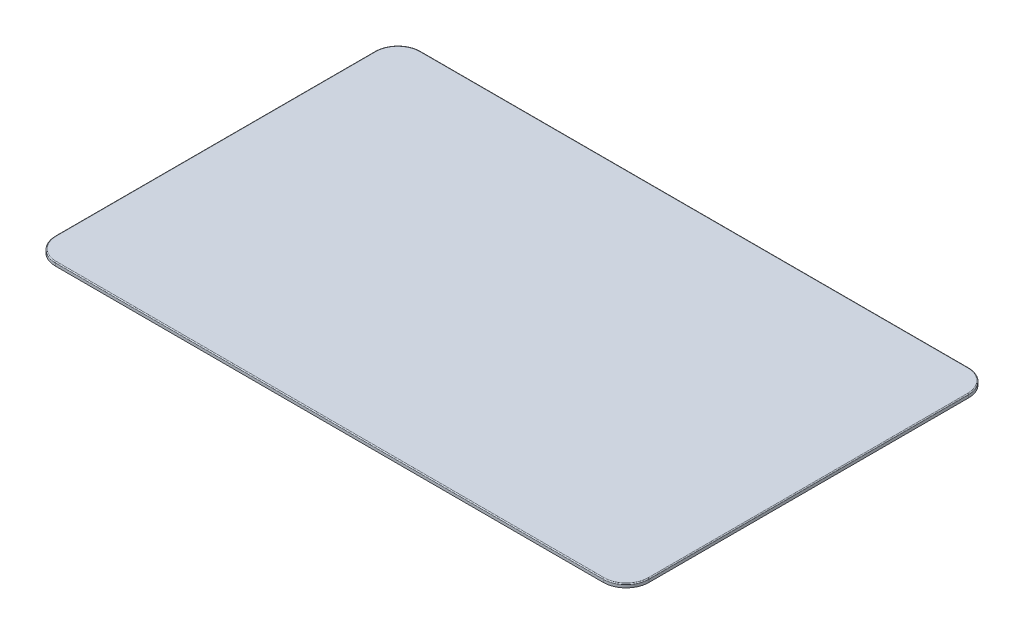
from build123d import *

# Parameters (mm, degrees)
EXTRUDE_1_DEPTH     = 8
FILLET_1_R          = 2
CUT_EXTRUDE_1_DEPTH = 6


with BuildPart() as part:
    # Эскиз1 → Бобышка-Вытянуть1 (new body)
    with BuildSketch(Plane(origin=(0, 0, 0), x_dir=(1, 0, 0), z_dir=(0, 1, 0))):
        with BuildLine():
            Line((-600, -400), (600, -400))
            ThreePointArc((600, -400), (635.355339059, -385.355339059), (650, -350))
            Line((650, -350), (650, 350))
            ThreePointArc((650, 350), (635.355339059, 385.355339059), (600, 400))
            Line((600, 400), (-600, 400))
            ThreePointArc((-600, 400), (-635.355339059, 385.355339059), (-650, 350))
            Line((-650, 350), (-650, -350))
            ThreePointArc((-650, -350), (-635.355339059, -385.355339059), (-600, -400))
        make_face()
    extrude(amount=EXTRUDE_1_DEPTH)

    # Скругление1
    fillet_1_edges = [part.edges().sort_by_distance(p)[0] for p in [
        (-635.355339059, 8, -385.355339059),
        (0, 8, -400),
        (635.355339059, 8, -385.355339059),
        (650, 8, 0),
        (635.355339059, 8, 385.355339059),
        (0, 8, 400),
        (-635.355339059, 8, 385.355339059),
        (-650, 8, 0),
    ]]
    fillet(fillet_1_edges, radius=FILLET_1_R)

    # Эскиз2 → Вырез-Вытянуть1 (cut)
    with BuildSketch(Plane.XZ):
        with BuildLine():
            Line((-505.5, -118.713883744), (-423, -118.713883744))
            ThreePointArc((-423, -118.713883744), (-419.464466094, -117.24941765), (-418, -113.713883744))
            Line((-418, -113.713883744), (-418, -29.5))
            ThreePointArc((-418, -29.5), (-416.535533906, -25.964466094), (-413, -24.5))
            ThreePointArc((-413, -24.5), (-409.464466094, -23.035533906), (-408, -19.5))
            ThreePointArc((-408, -19.5), (-406.535533906, -15.964466094), (-403, -14.5))
            Line((-403, -14.5), (-297.5, -14.5))
            Line((-297.5, -14.5), (-297.5, -207.927682204))
            ThreePointArc((-297.5, -207.927682204), (-298.971774478, -211.470509418), (-302.520649868, -212.927639562))
            Line((-302.520649868, -212.927639562), (-307.759216244, -212.906004237))
            ThreePointArc((-307.759216244, -212.906004237), (-312.019645969, -211.120626595), (-310.269519857, -215.395657982))
            Line((-310.269519857, -215.395657982), (-310.538832295, -280.604342018))
            ThreePointArc((-310.538832295, -280.604342018), (-312.320570836, -284.868433457), (-308.049157229, -283.104320697))
            Line((-308.049157229, -283.104320697), (-262.240805077, -283.104320697))
            ThreePointArc((-262.240805077, -283.104320697), (-257.973038124, -284.87208765), (-259.740805077, -280.604320697))
            Line((-259.740805077, -280.604320697), (-259.740805077, -218.125013383))
            ThreePointArc((-259.740805077, -218.125013383), (-258.269030598, -214.582186169), (-254.720155209, -213.125056025))
            Line((-254.720155209, -213.125056025), (-250, -213.144550308))
            Line((-250, -213.144550308), (-245.27984479, -213.125056025))
            ThreePointArc((-245.27984479, -213.125056025), (-241.730969401, -214.582186169), (-240.259194922, -218.125013383))
            Line((-240.259194922, -218.125013383), (-240.259194922, -280.604320697))
            ThreePointArc((-240.259194922, -280.604320697), (-242.026961875, -284.87208765), (-237.759194922, -283.104320697))
            Line((-237.759194922, -283.104320697), (-191.95084277, -283.104320697))
            ThreePointArc((-191.95084277, -283.104320697), (-187.679429163, -284.868433457), (-189.461167704, -280.604342018))
            Line((-189.461167704, -280.604342018), (-189.730480142, -215.395657982))
            ThreePointArc((-189.730480142, -215.395657982), (-187.98035403, -211.120626595), (-192.240783755, -212.906004237))
            Line((-192.240783755, -212.906004237), (-197.479350132, -212.927639562))
            ThreePointArc((-197.479350132, -212.927639562), (-201.028225521, -211.470509418), (-202.499999999, -207.927682204))
            Line((-202.499999999, -207.927682204), (-202.499999999, -179.286116256))
            ThreePointArc((-202.499999999, -179.286116256), (-203.964466093, -175.75058235), (-207.499999999, -174.286116256))
            Line((-207.499999999, -174.286116256), (-265.499999999, -174.286116256))
            ThreePointArc((-265.499999999, -174.286116256), (-269.035533905, -172.821650162), (-270.499999999, -169.286116256))
            Line((-270.499999999, -169.286116256), (-270.499999999, 174.286116256))
            ThreePointArc((-270.499999999, 174.286116256), (-269.035533905, 177.821650162), (-265.499999999, 179.286116256))
            Line((-265.499999999, 179.286116256), (-207.499999999, 179.286116256))
            ThreePointArc((-207.499999999, 179.286116256), (-203.964466093, 180.75058235), (-202.499999999, 184.286116256))
            Line((-202.499999999, 184.286116256), (-202.499999999, 207.927682204))
            ThreePointArc((-202.499999999, 207.927682204), (-201.028225521, 211.470509418), (-197.479350132, 212.927639562))
            Line((-197.479350132, 212.927639562), (-192.240783755, 212.906004237))
            ThreePointArc((-192.240783755, 212.906004237), (-187.98035403, 211.120626595), (-189.730480142, 215.395657982))
            Line((-189.730480142, 215.395657982), (-189.461167704, 280.604342018))
            ThreePointArc((-189.461167704, 280.604342018), (-187.679429163, 284.868433457), (-191.95084277, 283.104320697))
            Line((-191.95084277, 283.104320697), (-237.759194922, 283.104320697))
            ThreePointArc((-237.759194922, 283.104320697), (-242.026961875, 284.87208765), (-240.259194922, 280.604320697))
            Line((-240.259194922, 280.604320697), (-240.259194922, 218.104320697))
            ThreePointArc((-240.259194922, 218.104320697), (-241.723661016, 214.568786791), (-245.259194922, 213.104320697))
            Line((-245.259194922, 213.104320697), (-254.740805077, 213.104320697))
            ThreePointArc((-254.740805077, 213.104320697), (-258.276338983, 214.568786791), (-259.740805077, 218.104320697))
            Line((-259.740805077, 218.104320697), (-259.740805077, 280.604320697))
            ThreePointArc((-259.740805077, 280.604320697), (-257.973038124, 284.87208765), (-262.240805077, 283.104320697))
            Line((-262.240805077, 283.104320697), (-308.049157229, 283.104320697))
            ThreePointArc((-308.049157229, 283.104320697), (-312.320570836, 284.868433457), (-310.538832295, 280.604342018))
            Line((-310.538832295, 280.604342018), (-310.269519857, 215.395657982))
            ThreePointArc((-310.269519857, 215.395657982), (-312.019645969, 211.120626595), (-307.759216244, 212.906004237))
            Line((-307.759216244, 212.906004237), (-302.520649868, 212.927639562))
            ThreePointArc((-302.520649868, 212.927639562), (-298.971774478, 211.470509418), (-297.5, 207.927682204))
            Line((-297.5, 207.927682204), (-297.5, 14.5))
            Line((-297.5, 14.5), (-403, 14.5))
            ThreePointArc((-403, 14.5), (-406.535533906, 15.964466094), (-408, 19.5))
            ThreePointArc((-408, 19.5), (-409.464466094, 23.035533906), (-413, 24.5))
            ThreePointArc((-413, 24.5), (-416.535533906, 25.964466094), (-418, 29.5))
            Line((-418, 29.5), (-418, 113.713883744))
            ThreePointArc((-418, 113.713883744), (-419.464466094, 117.24941765), (-423, 118.713883744))
            Line((-423, 118.713883744), (-505.5, 118.713883744))
            ThreePointArc((-505.5, 118.713883744), (-509.035533906, 117.24941765), (-510.5, 113.713883744))
            Line((-510.5, 113.713883744), (-510.5, 85.072317796))
            ThreePointArc((-510.5, 85.072317796), (-511.971774479, 81.529490582), (-515.520649868, 80.072360438))
            Line((-515.520649868, 80.072360438), (-520.759216244, 80.093995763))
            ThreePointArc((-520.759216244, 80.093995763), (-525.019645969, 81.879373405), (-523.269519857, 77.604342018))
            Line((-523.269519857, 77.604342018), (-523.538832295, 12.395657982))
            ThreePointArc((-523.538832295, 12.395657982), (-525.320570836, 8.131566542), (-521.049157229, 9.895679303))
            Line((-521.049157229, 9.895679303), (-475.240805077, 9.895679303))
            ThreePointArc((-475.240805077, 9.895679303), (-470.973038124, 8.12791235), (-472.740805077, 12.395679303))
            Line((-472.740805077, 12.395679303), (-472.740805077, 77.395679303))
            ThreePointArc((-472.740805077, 77.395679303), (-470.96939147, 81.659792064), (-475.240783756, 79.906004237))
            Line((-475.240783756, 79.906004237), (-480.520649868, 79.92781013))
            ThreePointArc((-480.520649868, 79.92781013), (-484.042827214, 81.399541967), (-485.5, 84.927767488))
            Line((-485.5, 84.927767488), (-485.5, 88.713883744))
            ThreePointArc((-485.5, 88.713883744), (-484.035533906, 92.24941765), (-480.5, 93.713883744))
            Line((-480.5, 93.713883744), (-448, 93.713883744))
            ThreePointArc((-448, 93.713883744), (-444.464466094, 92.24941765), (-443, 88.713883744))
            Line((-443, 88.713883744), (-443, -88.713883744))
            ThreePointArc((-443, -88.713883744), (-444.464466094, -92.24941765), (-448, -93.713883744))
            Line((-448, -93.713883744), (-480.5, -93.713883744))
            ThreePointArc((-480.5, -93.713883744), (-484.035533906, -92.24941765), (-485.5, -88.713883744))
            Line((-485.5, -88.713883744), (-485.5, -84.927767488))
            ThreePointArc((-485.5, -84.927767488), (-484.042827214, -81.399541967), (-480.520649868, -79.92781013))
            Line((-480.520649868, -79.92781013), (-475.240783756, -79.906004237))
            ThreePointArc((-475.240783756, -79.906004237), (-470.96939147, -81.659792064), (-472.740805077, -77.395679303))
            Line((-472.740805077, -77.395679303), (-472.740805077, -12.395679303))
            ThreePointArc((-472.740805077, -12.395679303), (-470.973038124, -8.12791235), (-475.240805077, -9.895679303))
            Line((-475.240805077, -9.895679303), (-521.049157229, -9.895679303))
            ThreePointArc((-521.049157229, -9.895679303), (-525.320570836, -8.131566542), (-523.538832295, -12.395657982))
            Line((-523.538832295, -12.395657982), (-523.269519857, -77.604342018))
            ThreePointArc((-523.269519857, -77.604342018), (-525.019645969, -81.879373405), (-520.759216244, -80.093995763))
            Line((-520.759216244, -80.093995763), (-515.520649868, -80.072360438))
            ThreePointArc((-515.520649868, -80.072360438), (-511.971774479, -81.529490582), (-510.5, -85.072317796))
            Line((-510.5, -85.072317796), (-510.5, -113.713883744))
            ThreePointArc((-510.5, -113.713883744), (-509.035533906, -117.24941765), (-505.5, -118.713883744))
        make_face()
        with BuildLine():
            Line((302.520649868, -212.927639562), (307.759216244, -212.906004237))
            ThreePointArc((307.759216244, -212.906004237), (312.019645969, -211.120626595), (310.269519857, -215.395657982))
            Line((310.269519857, -215.395657982), (310.538832295, -280.604342018))
            ThreePointArc((310.538832295, -280.604342018), (312.320570836, -284.868433457), (308.049157229, -283.104320697))
            Line((308.049157229, -283.104320697), (262.240805077, -283.104320697))
            ThreePointArc((262.240805077, -283.104320697), (257.973038124, -284.87208765), (259.740805077, -280.604320697))
            Line((259.740805077, -280.604320697), (259.740805077, -218.093995763))
            ThreePointArc((259.740805077, -218.093995763), (258.276338983, -214.558461857), (254.740805077, -213.093995763))
            Line((254.740805077, -213.093995763), (245.259194922, -213.093995763))
            ThreePointArc((245.259194922, -213.093995763), (241.723661016, -214.558461857), (240.259194922, -218.093995763))
            Line((240.259194922, -218.093995763), (240.259194922, -280.604320697))
            ThreePointArc((240.259194922, -280.604320697), (242.026961875, -284.87208765), (237.759194922, -283.104320697))
            Line((237.759194922, -283.104320697), (191.95084277, -283.104320697))
            ThreePointArc((191.95084277, -283.104320697), (187.679429163, -284.868433457), (189.461167704, -280.604342018))
            Line((189.461167704, -280.604342018), (189.730480142, -215.395657982))
            ThreePointArc((189.730480142, -215.395657982), (187.98035403, -211.120626595), (192.240783755, -212.906004237))
            Line((192.240783755, -212.906004237), (197.479350132, -212.927639562))
            ThreePointArc((197.479350132, -212.927639562), (201.028225521, -211.470509418), (202.499999999, -207.927682204))
            Line((202.499999999, -207.927682204), (202.499999999, -184.286116256))
            ThreePointArc((202.499999999, -184.286116256), (203.964466093, -180.75058235), (207.499999999, -179.286116256))
            Line((207.499999999, -179.286116256), (265.499999999, -179.286116256))
            ThreePointArc((265.499999999, -179.286116256), (269.035533905, -177.821650162), (270.499999999, -174.286116256))
            Line((270.499999999, -174.286116256), (270.499999999, 169.286116256))
            ThreePointArc((270.499999999, 169.286116256), (269.035533905, 172.821650162), (265.499999999, 174.286116256))
            Line((265.499999999, 174.286116256), (207.499999999, 174.286116256))
            ThreePointArc((207.499999999, 174.286116256), (203.964466093, 175.75058235), (202.499999999, 179.286116256))
            Line((202.499999999, 179.286116256), (202.499999999, 207.927682204))
            ThreePointArc((202.499999999, 207.927682204), (201.028225521, 211.470509418), (197.479350132, 212.927639562))
            Line((197.479350132, 212.927639562), (192.240783755, 212.906004237))
            ThreePointArc((192.240783755, 212.906004237), (187.98035403, 211.120626595), (189.730480142, 215.395657982))
            Line((189.730480142, 215.395657982), (189.461167704, 280.604342018))
            ThreePointArc((189.461167704, 280.604342018), (187.679429163, 284.868433457), (191.95084277, 283.104320697))
            Line((191.95084277, 283.104320697), (237.759194922, 283.104320697))
            ThreePointArc((237.759194922, 283.104320697), (242.026961875, 284.87208765), (240.259194922, 280.604320697))
            Line((240.259194922, 280.604320697), (240.259194922, 218.125013383))
            ThreePointArc((240.259194922, 218.125013383), (241.730969401, 214.582186169), (245.27984479, 213.125056025))
            Line((245.27984479, 213.125056025), (250, 213.144550308))
            Line((250, 213.144550308), (254.720155209, 213.125056025))
            ThreePointArc((254.720155209, 213.125056025), (258.269030598, 214.582186169), (259.740805077, 218.125013383))
            Line((259.740805077, 218.125013383), (259.740805077, 280.604320697))
            ThreePointArc((259.740805077, 280.604320697), (257.973038124, 284.87208765), (262.240805077, 283.104320697))
            Line((262.240805077, 283.104320697), (308.049157229, 283.104320697))
            ThreePointArc((308.049157229, 283.104320697), (312.320570836, 284.868433457), (310.538832295, 280.604342018))
            Line((310.538832295, 280.604342018), (310.269519857, 215.395657982))
            ThreePointArc((310.269519857, 215.395657982), (312.019645969, 211.120626595), (307.759216244, 212.906004237))
            Line((307.759216244, 212.906004237), (302.520649868, 212.927639562))
            ThreePointArc((302.520649868, 212.927639562), (298.971774478, 211.470509418), (297.5, 207.927682204))
            Line((297.5, 207.927682204), (297.5, 19.5))
            ThreePointArc((297.5, 19.5), (298.964466094, 15.964466094), (302.5, 14.5))
            Line((302.5, 14.5), (403, 14.5))
            ThreePointArc((403, 14.5), (406.535533906, 15.964466094), (408, 19.5))
            ThreePointArc((408, 19.5), (409.464466094, 23.035533906), (413, 24.5))
            ThreePointArc((413, 24.5), (416.535533906, 25.964466094), (418, 29.5))
            Line((418, 29.5), (418, 113.713883744))
            ThreePointArc((418, 113.713883744), (419.464466094, 117.24941765), (423, 118.713883744))
            Line((423, 118.713883744), (505.5, 118.713883744))
            ThreePointArc((505.5, 118.713883744), (509.035533906, 117.24941765), (510.5, 113.713883744))
            Line((510.5, 113.713883744), (510.5, 85.072317796))
            ThreePointArc((510.5, 85.072317796), (511.971774479, 81.529490582), (515.520649868, 80.072360438))
            Line((515.520649868, 80.072360438), (520.759216244, 80.093995763))
            ThreePointArc((520.759216244, 80.093995763), (525.019645969, 81.879373405), (523.269519857, 77.604342018))
            Line((523.269519857, 77.604342018), (523.538832295, 12.395657982))
            ThreePointArc((523.538832295, 12.395657982), (525.320570836, 8.131566542), (521.049157229, 9.895679303))
            Line((521.049157229, 9.895679303), (475.240805077, 9.895679303))
            ThreePointArc((475.240805077, 9.895679303), (470.973038124, 8.12791235), (472.740805077, 12.395679303))
            Line((472.740805077, 12.395679303), (472.740805077, 77.395679303))
            ThreePointArc((472.740805077, 77.395679303), (470.96939147, 81.659792064), (475.240783756, 79.906004237))
            Line((475.240783756, 79.906004237), (480.520649868, 79.92781013))
            ThreePointArc((480.520649868, 79.92781013), (484.042827214, 81.399541967), (485.5, 84.927767488))
            Line((485.5, 84.927767488), (485.5, 88.713883744))
            ThreePointArc((485.5, 88.713883744), (484.035533906, 92.24941765), (480.5, 93.713883744))
            Line((480.5, 93.713883744), (448, 93.713883744))
            ThreePointArc((448, 93.713883744), (444.464466094, 92.24941765), (443, 88.713883744))
            Line((443, 88.713883744), (443, -88.713883744))
            ThreePointArc((443, -88.713883744), (444.464466094, -92.24941765), (448, -93.713883744))
            Line((448, -93.713883744), (480.5, -93.713883744))
            ThreePointArc((480.5, -93.713883744), (484.035533906, -92.24941765), (485.5, -88.713883744))
            Line((485.5, -88.713883744), (485.5, -84.927767488))
            ThreePointArc((485.5, -84.927767488), (484.042827214, -81.399541967), (480.520649868, -79.92781013))
            Line((480.520649868, -79.92781013), (475.240783756, -79.906004237))
            ThreePointArc((475.240783756, -79.906004237), (470.96939147, -81.659792064), (472.740805077, -77.395679303))
            Line((472.740805077, -77.395679303), (472.740805077, -12.395679303))
            ThreePointArc((472.740805077, -12.395679303), (470.973038124, -8.12791235), (475.240805077, -9.895679303))
            Line((475.240805077, -9.895679303), (521.049157229, -9.895679303))
            ThreePointArc((521.049157229, -9.895679303), (525.320570836, -8.131566542), (523.538832295, -12.395657982))
            Line((523.538832295, -12.395657982), (523.269519857, -77.604342018))
            ThreePointArc((523.269519857, -77.604342018), (525.019645969, -81.879373405), (520.759216244, -80.093995763))
            Line((520.759216244, -80.093995763), (515.520649868, -80.072360438))
            ThreePointArc((515.520649868, -80.072360438), (511.971774479, -81.529490582), (510.5, -85.072317796))
            Line((510.5, -85.072317796), (510.5, -113.713883744))
            ThreePointArc((510.5, -113.713883744), (509.035533906, -117.24941765), (505.5, -118.713883744))
            Line((505.5, -118.713883744), (423, -118.713883744))
            ThreePointArc((423, -118.713883744), (419.464466094, -117.24941765), (418, -113.713883744))
            Line((418, -113.713883744), (418, -29.5))
            ThreePointArc((418, -29.5), (416.535533906, -25.964466094), (413, -24.5))
            ThreePointArc((413, -24.5), (409.464466094, -23.035533906), (408, -19.5))
            ThreePointArc((408, -19.5), (406.535533906, -15.964466094), (403, -14.5))
            Line((403, -14.5), (302.5, -14.5))
            ThreePointArc((302.5, -14.5), (298.964466094, -15.964466094), (297.5, -19.5))
            Line((297.5, -19.5), (297.5, -207.927682204))
            ThreePointArc((297.5, -207.927682204), (298.971774478, -211.470509418), (302.520649868, -212.927639562))
        make_face()
        with BuildLine():
            Line((-102.176678262, 35.071051695), (-96.938111886, 35.092687021))
            ThreePointArc((-96.938111886, 35.092687021), (-92.677682161, 36.878064662), (-94.427808273, 32.603033275))
            Line((-94.427808273, 32.603033275), (-94.158495835, -32.60565076))
            ThreePointArc((-94.158495835, -32.60565076), (-92.376757294, -36.8697422), (-96.648170901, -35.105629439))
            Line((-96.648170901, -35.105629439), (-142.456523053, -35.105629439))
            ThreePointArc((-142.456523053, -35.105629439), (-146.724290006, -36.873396392), (-144.956523053, -32.605629439))
            Line((-144.956523053, -32.605629439), (-144.956523053, 32.394370561))
            ThreePointArc((-144.956523053, 32.394370561), (-146.72793666, 36.658483321), (-142.456544374, 34.904695494))
            Line((-142.456544374, 34.904695494), (-137.176678262, 34.926501388))
            ThreePointArc((-137.176678262, 34.926501388), (-133.654500916, 36.398233224), (-132.19732813, 39.926458746))
            Line((-132.19732813, 39.926458746), (-132.19732813, 110.071051695))
            ThreePointArc((-132.19732813, 110.071051695), (-130.732862036, 113.606585601), (-127.19732813, 115.071051695))
            Line((-127.19732813, 115.071051695), (127.80267187, 115.071051695))
            ThreePointArc((127.80267187, 115.071051695), (131.338205776, 113.606585601), (132.80267187, 110.071051695))
            Line((132.80267187, 110.071051695), (132.80267187, 40.071009054))
            ThreePointArc((132.80267187, 40.071009054), (134.368683547, 36.519880013), (137.969454992, 35.071655227))
            Line((137.969454992, 35.071655227), (143.061888114, 35.092687021))
            ThreePointArc((143.061888114, 35.092687021), (147.322317839, 36.878064662), (145.572191727, 32.603033275))
            Line((145.572191727, 32.603033275), (145.841504165, -32.60565076))
            ThreePointArc((145.841504165, -32.60565076), (147.623242706, -36.8697422), (143.351829099, -35.105629439))
            Line((143.351829099, -35.105629439), (97.543476947, -35.105629439))
            ThreePointArc((97.543476947, -35.105629439), (93.275709994, -36.873396392), (95.043476947, -32.605629439))
            Line((95.043476947, -32.605629439), (95.043476947, 32.394370561))
            ThreePointArc((95.043476947, 32.394370561), (93.27206334, 36.658483321), (97.543455626, 34.904695494))
            Line((97.543455626, 34.904695494), (102.070928869, 34.923393999))
            ThreePointArc((102.070928869, 34.923393999), (105.697122422, 36.438588713), (107.19732813, 40.071009054))
            Line((107.19732813, 40.071009054), (107.19732813, 85.071051695))
            ThreePointArc((107.19732813, 85.071051695), (105.732862036, 88.606585601), (102.19732813, 90.071051695))
            Line((102.19732813, 90.071051695), (17.19732813, 90.071051695))
            ThreePointArc((17.19732813, 90.071051695), (12.188175481, 84.749503723), (17.80267187, 80.071051695))
            Line((17.80267187, 80.071051695), (67.80267187, 80.071051695))
            ThreePointArc((67.80267187, 80.071051695), (71.338205776, 78.606585601), (72.80267187, 75.071051695))
            Line((72.80267187, 75.071051695), (72.80267187, 50.071051695))
            Line((72.80267187, 50.071051695), (72.80267187, 40.071009054))
            ThreePointArc((72.80267187, 40.071009054), (74.274446348, 36.528181839), (77.823321738, 35.071051695))
            Line((77.823321738, 35.071051695), (83.061888114, 35.092687021))
            ThreePointArc((83.061888114, 35.092687021), (87.322317839, 36.878064662), (85.572191727, 32.603033275))
            Line((85.572191727, 32.603033275), (85.841504165, -32.60565076))
            ThreePointArc((85.841504165, -32.60565076), (87.623242706, -36.8697422), (83.351829099, -35.105629439))
            Line((83.351829099, -35.105629439), (37.543476947, -35.105629439))
            ThreePointArc((37.543476947, -35.105629439), (33.275709994, -36.873396392), (35.043476947, -32.605629439))
            Line((35.043476947, -32.605629439), (35.043476947, 32.394370561))
            ThreePointArc((35.043476947, 32.394370561), (33.27206334, 36.658483321), (37.543455626, 34.904695494))
            Line((37.543455626, 34.904695494), (42.823321738, 34.926501388))
            ThreePointArc((42.823321738, 34.926501388), (46.345499084, 36.398233224), (47.80267187, 39.926458746))
            Line((47.80267187, 39.926458746), (47.80267187, 50.071051695))
            ThreePointArc((47.80267187, 50.071051695), (46.338205776, 53.606585601), (42.80267187, 55.071051695))
            Line((42.80267187, 55.071051695), (17.80267187, 55.071051695))
            ThreePointArc((17.80267187, 55.071051695), (14.267137964, 53.606585601), (12.80267187, 50.071051695))
            Line((12.80267187, 50.071051695), (12.80267187, 40.071009054))
            ThreePointArc((12.80267187, 40.071009054), (14.274446348, 36.528181839), (17.823321738, 35.071051695))
            Line((17.823321738, 35.071051695), (23.061888114, 35.092687021))
            ThreePointArc((23.061888114, 35.092687021), (27.322317839, 36.878064662), (25.572191727, 32.603033275))
            Line((25.572191727, 32.603033275), (25.841504165, -32.60565076))
            ThreePointArc((25.841504165, -32.60565076), (27.623242706, -36.8697422), (23.351829099, -35.105629439))
            Line((23.351829099, -35.105629439), (-22.456523053, -35.105629439))
            ThreePointArc((-22.456523053, -35.105629439), (-26.724290006, -36.873396392), (-24.956523053, -32.605629439))
            Line((-24.956523053, -32.605629439), (-24.956523053, 32.394370561))
            ThreePointArc((-24.956523053, 32.394370561), (-26.72793666, 36.658483321), (-22.456544374, 34.904695494))
            Line((-22.456544374, 34.904695494), (-17.176678262, 34.926501388))
            ThreePointArc((-17.176678262, 34.926501388), (-13.654500916, 36.398233224), (-12.19732813, 39.926458746))
            Line((-12.19732813, 39.926458746), (-12.19732813, 50.071051695))
            ThreePointArc((-12.19732813, 50.071051695), (-13.661794224, 53.606585601), (-17.19732813, 55.071051695))
            Line((-17.19732813, 55.071051695), (-42.19732813, 55.071051695))
            ThreePointArc((-42.19732813, 55.071051695), (-45.732862036, 53.606585601), (-47.19732813, 50.071051695))
            Line((-47.19732813, 50.071051695), (-47.19732813, 40.071009054))
            ThreePointArc((-47.19732813, 40.071009054), (-45.725553652, 36.528181839), (-42.176678262, 35.071051695))
            Line((-42.176678262, 35.071051695), (-36.938111886, 35.092687021))
            ThreePointArc((-36.938111886, 35.092687021), (-32.677682161, 36.878064662), (-34.427808273, 32.603033275))
            Line((-34.427808273, 32.603033275), (-34.158495835, -32.60565076))
            ThreePointArc((-34.158495835, -32.60565076), (-32.376757294, -36.8697422), (-36.648170901, -35.105629439))
            Line((-36.648170901, -35.105629439), (-82.456523053, -35.105629439))
            ThreePointArc((-82.456523053, -35.105629439), (-86.724290006, -36.873396392), (-84.956523053, -32.605629439))
            Line((-84.956523053, -32.605629439), (-84.956523053, 32.394370561))
            ThreePointArc((-84.956523053, 32.394370561), (-86.72793666, 36.658483321), (-82.456544374, 34.904695494))
            Line((-82.456544374, 34.904695494), (-77.176678262, 34.926501388))
            ThreePointArc((-77.176678262, 34.926501388), (-73.654500916, 36.398233224), (-72.19732813, 39.926458746))
            Line((-72.19732813, 39.926458746), (-72.19732813, 50.071051695))
            Line((-72.19732813, 50.071051695), (-72.19732813, 75.071051695))
            ThreePointArc((-72.19732813, 75.071051695), (-70.732862036, 78.606585601), (-67.19732813, 80.071051695))
            Line((-67.19732813, 80.071051695), (-17.19732813, 80.071051695))
            ThreePointArc((-17.19732813, 80.071051695), (-12.19732813, 85.071051695), (-17.19732813, 90.071051695))
            Line((-17.19732813, 90.071051695), (-102.19732813, 90.071051695))
            ThreePointArc((-102.19732813, 90.071051695), (-105.732862036, 88.606585601), (-107.19732813, 85.071051695))
            Line((-107.19732813, 85.071051695), (-107.19732813, 40.071009054))
            ThreePointArc((-107.19732813, 40.071009054), (-105.725553652, 36.528181839), (-102.176678262, 35.071051695))
        make_face()
    extrude(amount=-CUT_EXTRUDE_1_DEPTH, mode=Mode.SUBTRACT)


solid = part.part
